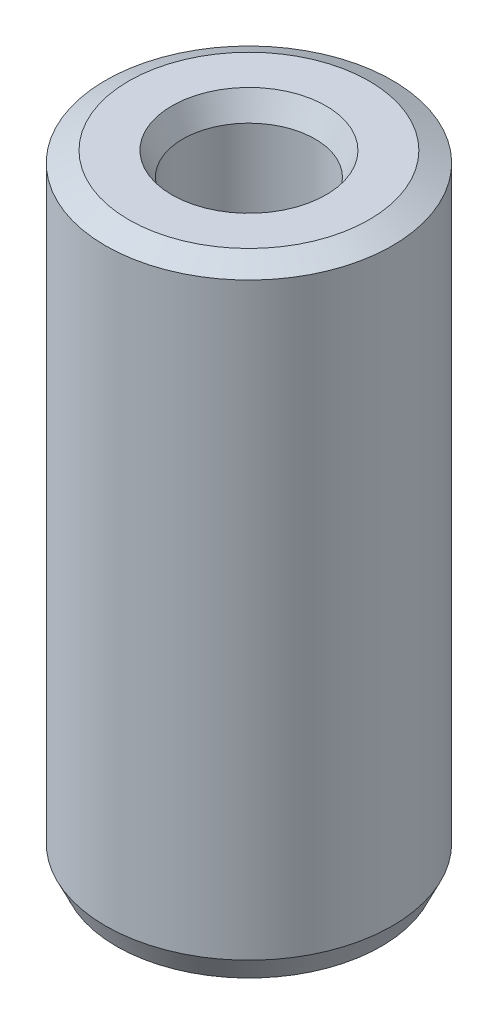
from build123d import *
from OCP.BRepFilletAPI import BRepFilletAPI_MakeChamfer

# Parameters (mm, degrees)
SKETCH1_R           = 40
BOSS_EXTRUDE1_DEPTH = 173.891652713
SKETCH2_R           = 18.454154694
CUT_EXTRUDE1_DEPTH  = 183.861441762
CHAMFER1_SIZE       = 3.062611932
CHAMFER1_SIZE2      = 6.467075665


with BuildPart() as part:
    # Sketch1 → Boss-Extrude1 (new body)
    with BuildSketch(Plane(origin=(0, 0, 0), x_dir=(1, 0, 0), z_dir=(0, 1, 0))):
        Circle(SKETCH1_R)
    extrude(amount=BOSS_EXTRUDE1_DEPTH)

    # Sketch2 → Cut-Extrude1 (cut, through all)
    with BuildSketch(Plane(origin=(0, 0, 0), x_dir=(1, 0, 0), z_dir=(0, 1, 0))):
        Circle(SKETCH2_R)
    extrude(amount=CUT_EXTRUDE1_DEPTH, mode=Mode.SUBTRACT)

    # Chamfer1: one chamfer whose edges measure the first distance from different faces: ONE call of the kernel's chamfer builder (chamfer() names one face for all edges)
    chamfer1_edges_1 = [part.edges().sort_by_distance(p)[0] for p in [
        (-18.454154694, 173.891652713, 0),
    ]]
    chamfer1_side_1 = [part.faces().sort_by_distance(p)[0] for p in [
        (-38.86862915, 173.891652713, 0),
    ]]
    chamfer1_edges_2 = [part.edges().sort_by_distance(p)[0] for p in [
        (-18.454154694, 0, 0),
    ]]
    chamfer1_side_2 = [part.faces().sort_by_distance(p)[0] for p in [
        (-18.454154694, 86.945826357, 0),
    ]]
    chamfer1_edges_3 = [part.edges().sort_by_distance(p)[0] for p in [
        (-40, 0, 0),
    ]]
    chamfer1_side_3 = [part.faces().sort_by_distance(p)[0] for p in [
        (-38.86862915, 0, 0),
    ]]
    chamfer1_edges_4 = [part.edges().sort_by_distance(p)[0] for p in [
        (-40, 173.891652713, 0),
    ]]
    chamfer1_side_4 = [part.faces().sort_by_distance(p)[0] for p in [
        (-40, 86.945826357, 0),
    ]]
    chamfer1 = BRepFilletAPI_MakeChamfer(part.part.solid().wrapped)
    for e in chamfer1_edges_1:
        chamfer1.Add(CHAMFER1_SIZE, CHAMFER1_SIZE2, e.wrapped, chamfer1_side_1[0].wrapped)  # the first distance lies on this face
    for e in chamfer1_edges_2:
        chamfer1.Add(CHAMFER1_SIZE, CHAMFER1_SIZE2, e.wrapped, chamfer1_side_2[0].wrapped)  # the first distance lies on this face
    for e in chamfer1_edges_3:
        chamfer1.Add(CHAMFER1_SIZE, CHAMFER1_SIZE2, e.wrapped, chamfer1_side_3[0].wrapped)  # the first distance lies on this face
    for e in chamfer1_edges_4:
        chamfer1.Add(CHAMFER1_SIZE, CHAMFER1_SIZE2, e.wrapped, chamfer1_side_4[0].wrapped)  # the first distance lies on this face
    add(Compound.cast(chamfer1.Shape()), mode=Mode.REPLACE)


solid = part.part
